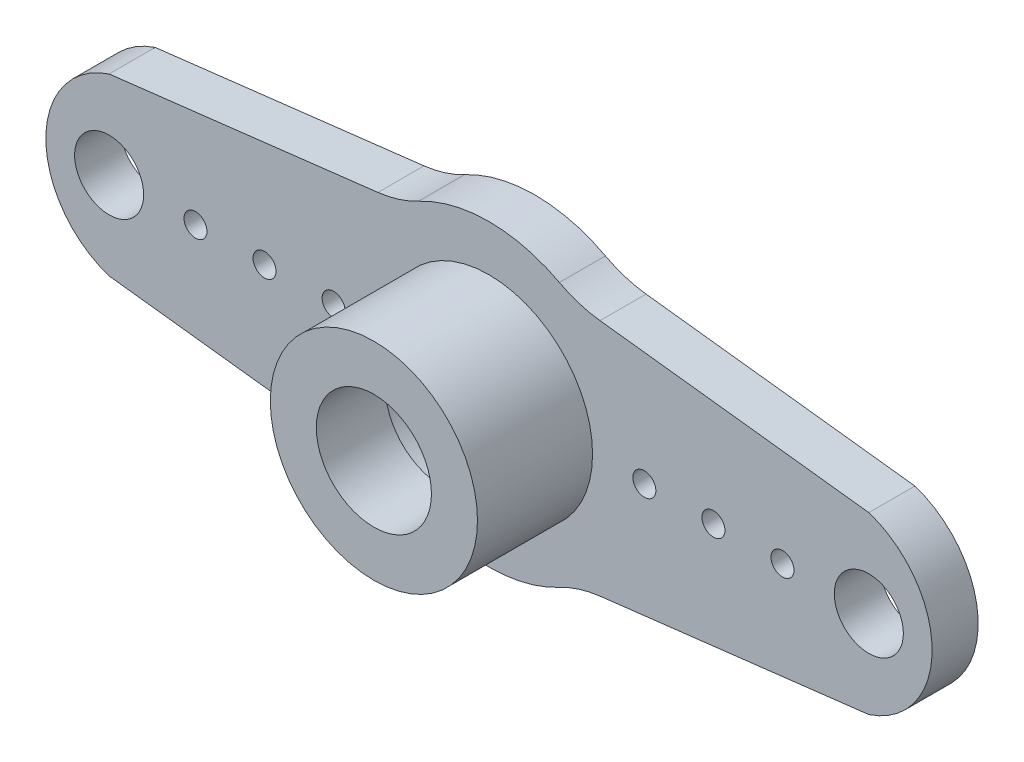
from build123d import *

# Parameters (mm, degrees)
SKETCH_1_R          = 0.5
EXTRUDE_1_DEPTH     = 2
SKETCH_2_R          = 4.5
SKETCH_2_R_2        = 2.5
EXTRUDE_2_DEPTH     = 5
SKETCH_3_R          = 3.5
CUT_EXTRUDE_1_DEPTH = 4
SKETCH_5_R          = 1.5
CUT_EXTRUDE_2_DEPTH = 10


with BuildPart() as part:
    # 草图1 → 凸台-拉伸1 (new body)
    with BuildSketch(Plane.XY):
        with BuildLine():
            Line((16.5, -3.799671038), (4.823155871, -5.182135299))
            ThreePointArc((4.823155871, -5.182135299), (3.914969309, -5.376520098), (3.058401724, -5.735519061))
            ThreePointArc((3.058401724, -5.735519061), (0, -6.5), (-3.058401724, -5.735519061))
            ThreePointArc((-3.058401724, -5.735519061), (-3.914969309, -5.376520098), (-4.823155871, -5.182135299))
            Line((-4.823155871, -5.182135299), (-16.5, -3.799671038))
            ThreePointArc((-16.5, -3.799671038), (-19.25, 0), (-16.5, 3.799671038))
            Line((-16.5, 3.799671038), (-4.823155871, 5.182135299))
            ThreePointArc((-4.823155871, 5.182135299), (-3.914969309, 5.376520098), (-3.058401724, 5.735519061))
            ThreePointArc((-3.058401724, 5.735519061), (0, 6.5), (3.058401724, 5.735519061))
            ThreePointArc((3.058401724, 5.735519061), (3.914969309, 5.376520098), (4.823155871, 5.182135299))
            Line((4.823155871, 5.182135299), (16.5, 3.799671038))
            ThreePointArc((16.5, 3.799671038), (19.25, 0), (16.5, -3.799671038))
        make_face()
        with Locations((-16.5, 0)):
            Circle(SKETCH_1_R, mode=Mode.SUBTRACT)
        with Locations((-12.75, 0)):
            Circle(SKETCH_1_R, mode=Mode.SUBTRACT)
        with Locations((-9.75, 0)):
            Circle(SKETCH_1_R, mode=Mode.SUBTRACT)
        with Locations((-6.75, 0)):
            Circle(SKETCH_1_R, mode=Mode.SUBTRACT)
        with Locations((-3.75, 0)):
            Circle(SKETCH_1_R, mode=Mode.SUBTRACT)
        with Locations((3.75, 0)):
            Circle(SKETCH_1_R, mode=Mode.SUBTRACT)
        with Locations((6.75, 0)):
            Circle(SKETCH_1_R, mode=Mode.SUBTRACT)
        with Locations((9.75, 0)):
            Circle(SKETCH_1_R, mode=Mode.SUBTRACT)
        with Locations((12.75, 0)):
            Circle(SKETCH_1_R, mode=Mode.SUBTRACT)
        with Locations((16.5, 0)):
            Circle(SKETCH_1_R, mode=Mode.SUBTRACT)
    extrude(amount=EXTRUDE_1_DEPTH)

    # 草图2 → 凸台-拉伸2 (add)
    with BuildSketch(Plane.XY.offset(2)):
        Circle(SKETCH_2_R)
        Circle(SKETCH_2_R_2, mode=Mode.SUBTRACT)
    extrude(amount=EXTRUDE_2_DEPTH)

    # 草图3 → 切除-拉伸1 (cut)
    with BuildSketch(Plane(origin=(0, 0, 0), x_dir=(-1, 0, 0), z_dir=(0, 0, -1))):
        Circle(SKETCH_3_R)
    extrude(amount=-CUT_EXTRUDE_1_DEPTH, mode=Mode.SUBTRACT)

    # 草图5 → 切除-拉伸2 (cut)
    with BuildSketch(Plane.XY.offset(2)):
        with Locations((16.5, 0)):
            Circle(SKETCH_5_R)
        with Locations((-16.5, 0)):
            Circle(SKETCH_5_R)
    extrude(amount=-CUT_EXTRUDE_2_DEPTH, mode=Mode.SUBTRACT)


solid = part.part
